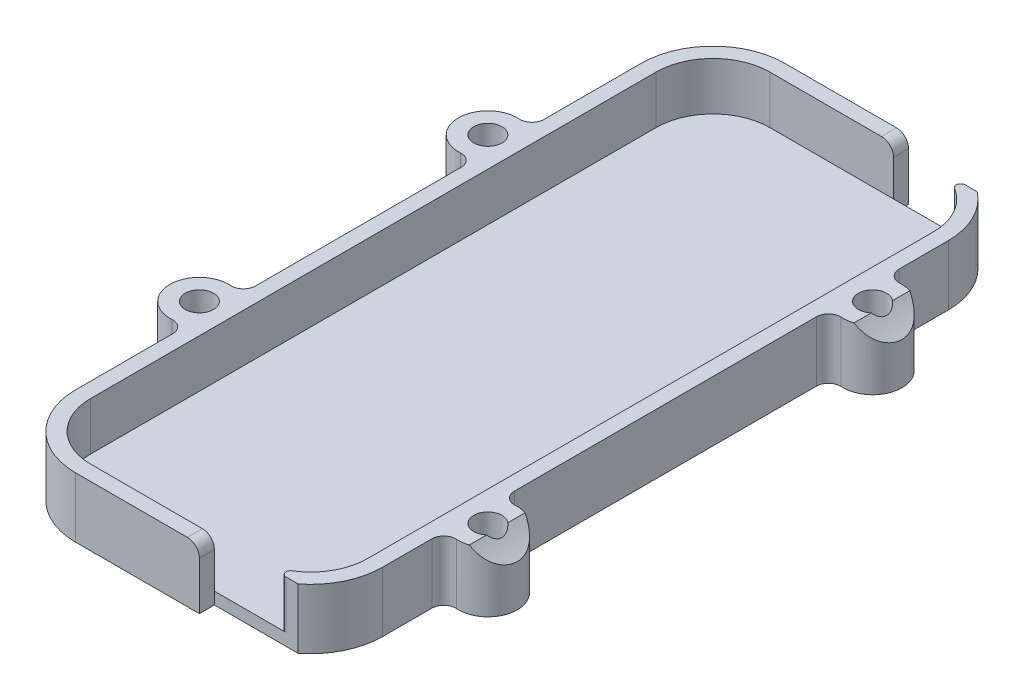
from build123d import *

# Parameters (mm, degrees)
EXTRUDE_THIN1_DEPTH          = 10
BOSS_EXTRUDE1_DEPTH          = 2
SKETCH2_W                    = 25.834060226
SKETCH2_H                    = 7.264687176
SKETCH2_W_2                  = 26.707196626
SKETCH2_H_2                  = 6.244092899
CUT_EXTRUDE1_DEPTH           = 92.75076294
SKETCH3_R                    = 4.9
BOSS_EXTRUDE2_DEPTH          = 10
FILLET1_START                = 34.65
FILLET1_DEPTH                = 9.35
FILLET2_R                    = 2
CUT_EXTRUDE2_DEPTH           = 106.894440364
CUT_EXTRUDE2_DEPTH_BACK      = 106.894440364
SKETCH5_R                    = 19.1
SKETCH6_R                    = 2.6162
CUT_EXTRUDE3_DEPTH           = 5
CUT_EXTRUDE3_DRAFT           = -8
CUT_EXTRUDE3_PROFILE_2_DEPTH = 5
CUT_EXTRUDE3_PROFILE_2_DRAFT = -8
CUT_EXTRUDE3_PROFILE_3_DEPTH = 5
CUT_EXTRUDE3_PROFILE_3_DRAFT = -8
CUT_EXTRUDE3_PROFILE_4_DEPTH = 5
CUT_EXTRUDE3_PROFILE_4_DRAFT = -8
SKETCH7_R                    = 2.3495
CUT_EXTRUDE4_DEPTH           = 98.440289419


with BuildPart() as part:
    # Sketch1 → Extrude-Thin1 (new body)
    with BuildSketch(Plane(origin=(0, 32.65, 0), x_dir=(1, 0, 0), z_dir=(0, 1, 0))):
        with BuildLine():
            Line((-69.55, 47.05), (-69.55, -47.05))
            ThreePointArc((-69.55, -47.05), (-66.049926035, -55.499926035), (-57.6, -59))
            Line((-57.6, -59), (-30.4, -59))
            ThreePointArc((-30.4, -59), (-21.950073965, -55.499926035), (-18.45, -47.05))
            Line((-18.45, -47.05), (-18.45, 47.05))
            ThreePointArc((-18.45, 47.05), (-21.950073965, 55.499926035), (-30.4, 59))
            Line((-30.4, 59), (-57.6, 59))
            ThreePointArc((-57.6, 59), (-66.049926035, 55.499926035), (-69.55, 47.05))
        make_face()
        with BuildLine():
            Line((-67.05, 47.05), (-67.05, -47.05))
            ThreePointArc((-67.05, -47.05), (-64.282159082, -53.732159082), (-57.6, -56.5))
            Line((-57.6, -56.5), (-30.4, -56.5))
            ThreePointArc((-30.4, -56.5), (-23.717840918, -53.732159082), (-20.95, -47.05))
            Line((-20.95, -47.05), (-20.95, 47.05))
            ThreePointArc((-20.95, 47.05), (-23.717840918, 53.732159082), (-30.4, 56.5))
            Line((-30.4, 56.5), (-57.6, 56.5))
            ThreePointArc((-57.6, 56.5), (-64.282159082, 53.732159082), (-67.05, 47.05))
        make_face(mode=Mode.SUBTRACT)
    extrude(amount=EXTRUDE_THIN1_DEPTH)

    # Sketch1<2> → Boss-Extrude1 (add)
    with BuildSketch(Plane(origin=(0, 32.65, 0), x_dir=(1, 0, 0), z_dir=(0, 1, 0))):
        with BuildLine():
            Line((-20.95, -47.05), (-20.95, 47.05))
            ThreePointArc((-20.95, 47.05), (-23.717840918, 53.732159082), (-30.4, 56.5))
            Line((-30.4, 56.5), (-57.6, 56.5))
            ThreePointArc((-57.6, 56.5), (-64.282159082, 53.732159082), (-67.05, 47.05))
            Line((-67.05, 47.05), (-67.05, -47.05))
            ThreePointArc((-67.05, -47.05), (-64.282159082, -53.732159082), (-57.6, -56.5))
            Line((-57.6, -56.5), (-30.4, -56.5))
            ThreePointArc((-30.4, -56.5), (-23.717840918, -53.732159082), (-20.95, -47.05))
        make_face()
    extrude(amount=BOSS_EXTRUDE1_DEPTH)

    # Sketch2 → Cut-Extrude1 (cut, through all)
    with BuildSketch(Plane(origin=(0, 42.65, 0), x_dir=(1, 0, 0), z_dir=(0, 1, 0))):
        with Locations((-24.082969887, 60.132343588)):
            Rectangle(SKETCH2_W, SKETCH2_H)
        with Locations((-23.646401687, -59.62204645)):
            Rectangle(SKETCH2_W_2, SKETCH2_H_2)
    extrude(amount=-CUT_EXTRUDE1_DEPTH, mode=Mode.SUBTRACT)

    # Sketch3 → Boss-Extrude2 (add)
    with BuildSketch(Plane(origin=(0, 42.65, 0), x_dir=(1, 0, 0), z_dir=(0, 1, 0))):
        with Locations((-72, -24)):
            Circle(SKETCH3_R)
        with Locations((-16, -32)):
            Circle(SKETCH3_R)
        with Locations((-16, 32)):
            Circle(SKETCH3_R)
        with Locations((-72, 24)):
            Circle(SKETCH3_R)
    extrude(amount=-BOSS_EXTRUDE2_DEPTH)

    # Fillet1: read off the stored shape, not the designer's step
    # Fillet1 outline → Fillet1 (cut)
    with BuildSketch(Plane(origin=(0, 0, 0), x_dir=(1, 0, 0), z_dir=(0, 1, 0)).offset(FILLET1_START)):
        with BuildLine():
            ThreePointArc((-30.4, 56.5), (-27.837508967, 56.145940837), (-25.467033475, 55.110294118))
            ThreePointArc((-25.467033475, 55.110294118), (-25.797428262, 55.953372305), (-25.075528195, 56.5))
            Line((-25.075528195, 56.5), (-30.4, 56.5))
        make_face()
        with BuildLine():
            Line((-30.4, -56.5), (-25.075528195, -56.5))
            ThreePointArc((-25.075528195, -56.5), (-25.797428262, -55.953372305), (-25.467033475, -55.110294118))
            ThreePointArc((-25.467033475, -55.110294118), (-27.837508967, -56.145940837), (-30.4, -56.5))
        make_face()
    extrude(amount=FILLET1_DEPTH, mode=Mode.SUBTRACT)

    # Fillet2
    fillet2_edges = [part.edges().sort_by_distance(p)[0] for p in [
        (-69.55, 37.65, 28.243524479),
        (-69.55, 37.65, 19.756475521),
        (-18.45, 37.65, 27.756475521),
        (-18.45, 37.65, 36.243524479),
        (-18.45, 37.65, -36.243524479),
        (-18.45, 37.65, -27.756475521),
        (-69.55, 37.65, -28.243524479),
        (-69.55, 37.65, -19.756475521),
        (-37, 42.65, -57.75),
        (-37, 42.65, 57.75),
    ]]
    fillet(fillet2_edges, radius=FILLET2_R)

    # Sketch5 → Cut-Extrude2 (cut, two sides: drawn at the far end of the back side and taken through both)
    with BuildSketch(Plane.XY.offset(-CUT_EXTRUDE2_DEPTH_BACK)):
        with Locations((0, 55.15)):
            Circle(SKETCH5_R)
    extrude(amount=CUT_EXTRUDE2_DEPTH + CUT_EXTRUDE2_DEPTH_BACK, mode=Mode.SUBTRACT)


with BuildPart() as cut_extrude3_tool:
    # Sketch6 → Cut-Extrude3 (with draft: the straight prism first)
    with BuildSketch(Plane.XZ.offset(-32.65)):
        with Locations((-72, 24)):
            Circle(SKETCH6_R)
    extrude(amount=-CUT_EXTRUDE3_DEPTH)
    # Cut-Extrude3: the draft: its side faces are tilted about the plane it starts from
    cut_extrude3_sides = [cut_extrude3_tool.faces().sort_by_distance(p)[0] for p in [
        (-74.6162, 35.15, 24),
    ]]
    draft(cut_extrude3_sides, Plane.XZ.offset(-32.65), CUT_EXTRUDE3_DRAFT)


with BuildPart() as part_1:
    add(part.part)

    # Cut-Extrude3: cut by cut_extrude3_tool
    add(cut_extrude3_tool.part, mode=Mode.SUBTRACT)


with BuildPart() as cut_extrude3_profile_2_tool:
    # Sketch6 → Cut-Extrude3 profile 2 (with draft: the straight prism first)
    with BuildSketch(Plane.XZ.offset(-32.65)):
        with Locations((-16, 32)):
            Circle(SKETCH6_R)
    extrude(amount=-CUT_EXTRUDE3_PROFILE_2_DEPTH)
    # Cut-Extrude3 profile 2: the draft: its side faces are tilted about the plane it starts from
    cut_extrude3_profile_2_sides = [cut_extrude3_profile_2_tool.faces().sort_by_distance(p)[0] for p in [
        (-18.6162, 35.15, 32),
    ]]
    draft(cut_extrude3_profile_2_sides, Plane.XZ.offset(-32.65), CUT_EXTRUDE3_PROFILE_2_DRAFT)


with BuildPart() as part_2:
    add(part_1.part)

    # Cut-Extrude3 profile 2: cut by cut_extrude3_profile_2_tool
    add(cut_extrude3_profile_2_tool.part, mode=Mode.SUBTRACT)


with BuildPart() as cut_extrude3_profile_3_tool:
    # Sketch6 → Cut-Extrude3 profile 3 (with draft: the straight prism first)
    with BuildSketch(Plane.XZ.offset(-32.65)):
        with Locations((-16, -32)):
            Circle(SKETCH6_R)
    extrude(amount=-CUT_EXTRUDE3_PROFILE_3_DEPTH)
    # Cut-Extrude3 profile 3: the draft: its side faces are tilted about the plane it starts from
    cut_extrude3_profile_3_sides = [cut_extrude3_profile_3_tool.faces().sort_by_distance(p)[0] for p in [
        (-18.6162, 35.15, -32),
    ]]
    draft(cut_extrude3_profile_3_sides, Plane.XZ.offset(-32.65), CUT_EXTRUDE3_PROFILE_3_DRAFT)


with BuildPart() as part_3:
    add(part_2.part)

    # Cut-Extrude3 profile 3: cut by cut_extrude3_profile_3_tool
    add(cut_extrude3_profile_3_tool.part, mode=Mode.SUBTRACT)


with BuildPart() as cut_extrude3_profile_4_tool:
    # Sketch6 → Cut-Extrude3 profile 4 (with draft: the straight prism first)
    with BuildSketch(Plane.XZ.offset(-32.65)):
        with Locations((-72, -24)):
            Circle(SKETCH6_R)
    extrude(amount=-CUT_EXTRUDE3_PROFILE_4_DEPTH)
    # Cut-Extrude3 profile 4: the draft: its side faces are tilted about the plane it starts from
    cut_extrude3_profile_4_sides = [cut_extrude3_profile_4_tool.faces().sort_by_distance(p)[0] for p in [
        (-74.6162, 35.15, -24),
    ]]
    draft(cut_extrude3_profile_4_sides, Plane.XZ.offset(-32.65), CUT_EXTRUDE3_PROFILE_4_DRAFT)


with BuildPart() as part_4:
    add(part_3.part)

    # Cut-Extrude3 profile 4: cut by cut_extrude3_profile_4_tool
    add(cut_extrude3_profile_4_tool.part, mode=Mode.SUBTRACT)

    # Sketch7 → Cut-Extrude4 (cut, through all)
    with BuildSketch(Plane.XZ.offset(-32.65)):
        with Locations(Location((-72, 24, 0), (0, 0, 270))):
            Circle(SKETCH7_R)
        with Locations(Location((-16, 32, 0), (0, 0, 270))):
            Circle(SKETCH7_R)
        with Locations(Location((-16, -32, 0), (0, 0, 270))):
            Circle(SKETCH7_R)
        with Locations(Location((-72, -24, 0), (0, 0, 270))):
            Circle(SKETCH7_R)
    extrude(amount=-CUT_EXTRUDE4_DEPTH, mode=Mode.SUBTRACT)


solid = part_4.part
